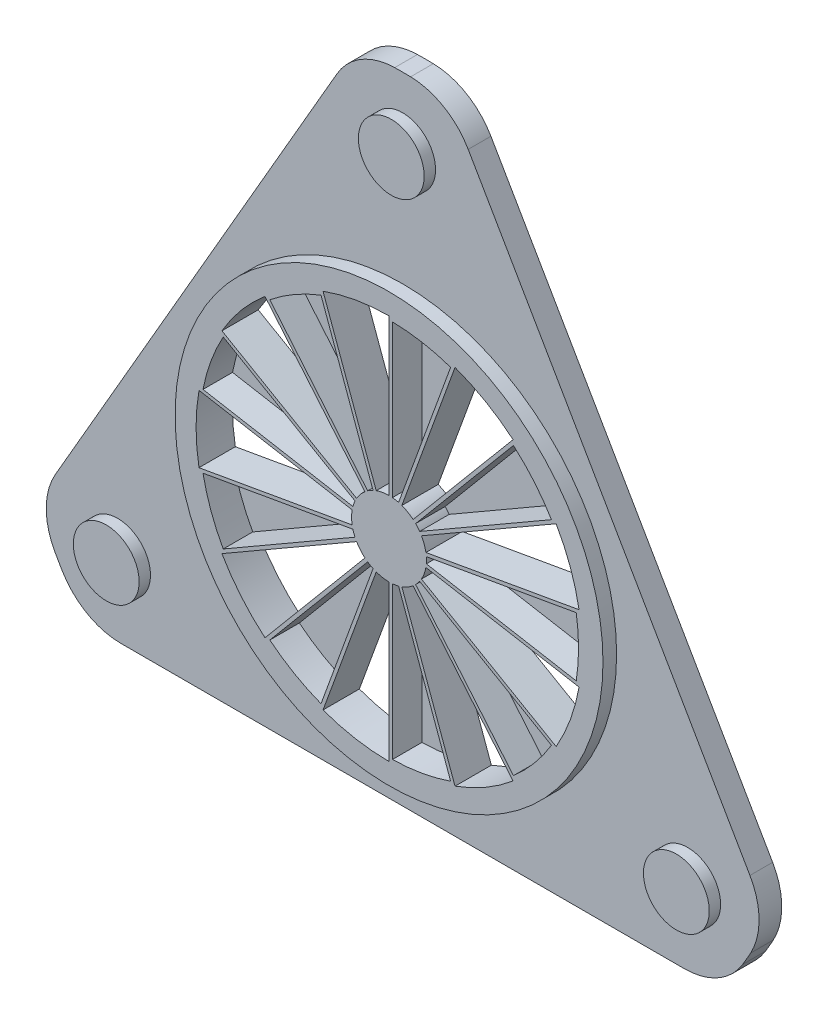
from build123d import *
from build123d.topology import SkipClean

# Parameters (mm, degrees)
SKETCH2_R           = 18.85
BOSS_EXTRUDE1_DEPTH = 3.2
BOSS_EXTRUDE7_START = -0.6
BOSS_EXTRUDE7_DEPTH = 0.6
FILLET1_START       = 6.8
FILLET1_OUTLINE_R   = 18.85
FILLET1_DEPTH       = 2
FILLET1_START_2     = 8.8
FILLET1_2_OUTLINE_R = 2.9
FILLET1_2_DEPTH     = 1
FILLET1_START_3     = 9.8
FILLET1_3_DEPTH     = 0.2


with BuildPart() as part:
    # Sketch2 → Boss-Extrude1 (new body)
    # profile 1 of 37: a face of its own
    with BuildSketch(Plane.XY.offset(10)):
        Circle(SKETCH2_R)
        with BuildLine():
            ThreePointArc((-5.814342437, 15.974774553), (-2.95201902, 16.741731801), (0, 17))
            ThreePointArc((0, 17), (2.95201902, 16.741731801), (5.814342437, 15.974774553))
            ThreePointArc((5.814342437, 15.974774553), (8.5, 14.722431864), (10.927389365, 13.022755533))
            ThreePointArc((10.927389365, 13.022755533), (13.022755533, 10.927389365), (14.722431864, 8.5))
            ThreePointArc((14.722431864, 8.5), (15.974774553, 5.814342437), (16.741731801, 2.95201902))
            ThreePointArc((16.741731801, 2.95201902), (16.935309868, 1.481647627), (17, 0))
            ThreePointArc((17, 0), (16.935309868, -1.481647627), (16.741731801, -2.95201902))
            ThreePointArc((16.741731801, -2.95201902), (15.974774553, -5.814342437), (14.722431864, -8.5))
            ThreePointArc((14.722431864, -8.5), (13.022755533, -10.927389365), (10.927389365, -13.022755533))
            ThreePointArc((10.927389365, -13.022755533), (8.5, -14.722431864), (5.814342437, -15.974774553))
            ThreePointArc((5.814342437, -15.974774553), (2.95201902, -16.741731801), (0, -17))
            ThreePointArc((0, -17), (-2.95201902, -16.741731801), (-5.814342437, -15.974774553))
            ThreePointArc((-5.814342437, -15.974774553), (-8.5, -14.722431864), (-10.927389365, -13.022755533))
            ThreePointArc((-10.927389365, -13.022755533), (-13.022755533, -10.927389365), (-14.722431864, -8.5))
            ThreePointArc((-14.722431864, -8.5), (-15.974774553, -5.814342437), (-16.741731801, -2.95201902))
            ThreePointArc((-16.741731801, -2.95201902), (-17, 0), (-16.741731801, 2.95201902))
            ThreePointArc((-16.741731801, 2.95201902), (-15.974774553, 5.814342437), (-14.722431864, 8.5))
            ThreePointArc((-14.722431864, 8.5), (-13.022755533, 10.927389365), (-10.927389365, 13.022755533))
            ThreePointArc((-10.927389365, 13.022755533), (-8.5, 14.722431864), (-5.814342437, 15.974774553))
        make_face(mode=Mode.SUBTRACT)
    # profile 2 of 37: a face of its own
    with BuildSketch(Plane.XY.offset(10)):
        with BuildLine():
            Line((0, 17), (0, 16.697537549))
            ThreePointArc((0, 16.697537549), (0.150006053, 16.696863729), (0.3, 16.694842323))
            ThreePointArc((0.3, 16.694842323), (2.899496967, 16.443864434), (5.428064578, 15.790626179))
            ThreePointArc((5.428064578, 15.790626179), (5.569704144, 15.741224728), (5.710894186, 15.69055282))
            Line((5.710894186, 15.69055282), (5.814342437, 15.974774553))
            ThreePointArc((5.814342437, 15.974774553), (2.95201902, 16.741731801), (0, 17))
        make_face()
    # profile 3 of 37: a face of its own
    with BuildSketch(Plane.XY.offset(10)):
        with BuildLine():
            ThreePointArc((-5.99188015, 15.585414093), (-5.851623307, 15.638614544), (-5.710894186, 15.69055282))
            Line((-5.710894186, 15.69055282), (-5.814342437, 15.974774553))
            ThreePointArc((-5.814342437, 15.974774553), (-8.5, 14.722431864), (-10.927389365, 13.022755533))
            Line((-10.927389365, 13.022755533), (-10.732970249, 12.791055853))
            ThreePointArc((-10.732970249, 12.791055853), (-10.617625822, 12.886961709), (-10.501424458, 12.981827473))
            ThreePointArc((-10.501424458, 12.981827473), (-8.348768774, 14.460491698), (-5.99188015, 15.585414093))
        make_face()
    # profile 4 of 37: a face of its own
    with BuildSketch(Plane.XY.offset(10)):
        with BuildLine():
            ThreePointArc((-14.608157564, 8.08761354), (-14.534911179, 8.218522811), (-14.460491698, 8.348768774))
            Line((-14.460491698, 8.348768774), (-14.722431864, 8.5))
            ThreePointArc((-14.722431864, 8.5), (-15.974774553, 5.814342437), (-16.741731801, 2.95201902))
            Line((-16.741731801, 2.95201902), (-16.443864434, 2.899496967))
            ThreePointArc((-16.443864434, 2.899496967), (-16.417152573, 3.047107084), (-16.389115702, 3.194471272))
            ThreePointArc((-16.389115702, 3.194471272), (-15.69055282, 5.710894186), (-14.608157564, 8.08761354))
        make_face()
    # profile 5 of 37: a face of its own
    with BuildSketch(Plane.XY.offset(10)):
        with BuildLine():
            ThreePointArc((-16.389115702, -3.194471272), (-16.417152573, -3.047107084), (-16.443864434, -2.899496967))
            Line((-16.443864434, -2.899496967), (-16.741731801, -2.95201902))
            ThreePointArc((-16.741731801, -2.95201902), (-15.974774553, -5.814342437), (-14.722431864, -8.5))
            Line((-14.722431864, -8.5), (-14.460491698, -8.348768774))
            ThreePointArc((-14.460491698, -8.348768774), (-14.534911179, -8.218522811), (-14.608157564, -8.08761354))
            ThreePointArc((-14.608157564, -8.08761354), (-15.69055282, -5.710894186), (-16.389115702, -3.194471272))
        make_face()
    # profile 6 of 37: a face of its own
    with BuildSketch(Plane.XY.offset(10)):
        with BuildLine():
            ThreePointArc((-10.501424458, -12.981827473), (-10.617625822, -12.886961709), (-10.732970249, -12.791055853))
            Line((-10.732970249, -12.791055853), (-10.927389365, -13.022755533))
            ThreePointArc((-10.927389365, -13.022755533), (-8.5, -14.722431864), (-5.814342437, -15.974774553))
            Line((-5.814342437, -15.974774553), (-5.710894186, -15.69055282))
            ThreePointArc((-5.710894186, -15.69055282), (-5.851623307, -15.638614544), (-5.99188015, -15.585414093))
            ThreePointArc((-5.99188015, -15.585414093), (-8.348768774, -14.460491698), (-10.501424458, -12.981827473))
        make_face()
    # profile 7 of 37: a face of its own
    with BuildSketch(Plane.XY.offset(10)):
        with BuildLine():
            Line((5.814342437, -15.974774553), (5.710894186, -15.69055282))
            ThreePointArc((5.710894186, -15.69055282), (5.569704144, -15.741224728), (5.428064578, -15.790626179))
            ThreePointArc((5.428064578, -15.790626179), (2.899496967, -16.443864434), (0.3, -16.694842323))
            ThreePointArc((0.3, -16.694842323), (0.150006053, -16.696863729), (0, -16.697537549))
            Line((0, -16.697537549), (0, -17))
            ThreePointArc((0, -17), (2.95201902, -16.741731801), (5.814342437, -15.974774553))
        make_face()
    # profile 8 of 37: a face of its own
    with BuildSketch(Plane.XY.offset(10)):
        with BuildLine():
            Line((14.722431864, -8.5), (14.460491698, -8.348768774))
            ThreePointArc((14.460491698, -8.348768774), (14.384905126, -8.478340917), (14.308157564, -8.607228783))
            ThreePointArc((14.308157564, -8.607228783), (12.791055853, -10.732970249), (10.961051124, -12.596154907))
            ThreePointArc((10.961051124, -12.596154907), (10.847448429, -12.694117644), (10.732970249, -12.791055853))
            Line((10.732970249, -12.791055853), (10.927389365, -13.022755533))
            ThreePointArc((10.927389365, -13.022755533), (13.022755533, -10.927389365), (14.722431864, -8.5))
        make_face()
    # profile 9 of 37: a face of its own
    with BuildSketch(Plane.XY.offset(10)):
        with BuildLine():
            ThreePointArc((0.842085099, 3.190751116), (0.986397435, 3.149130054), (1.128666473, 3.100985649))
            Line((1.128666473, 3.100985649), (5.710894186, 15.69055282))
            ThreePointArc((5.710894186, 15.69055282), (5.569704144, 15.741224728), (5.428064578, 15.790626179))
            Line((5.428064578, 15.790626179), (0.842085099, 3.190751116))
        make_face()
    # profile 10 of 37: a face of its own
    with BuildSketch(Plane.XY.offset(10)):
        with BuildLine():
            Line((0, 16.697537549), (0, 3.3))
            ThreePointArc((0, 3.3), (0.150155522, 3.296582066), (0.3, 3.286335345))
            Line((0.3, 3.286335345), (0.3, 16.694842323))
            ThreePointArc((0.3, 16.694842323), (0.150006053, 16.696863729), (0, 16.697537549))
        make_face()
    # profile 11 of 37: a face of its own
    with BuildSketch(Plane.XY.offset(10)):
        with BuildLine():
            ThreePointArc((-1.405900672, 2.98553903), (-1.268597506, 3.046417628), (-1.128666473, 3.100985649))
            Line((-1.128666473, 3.100985649), (-5.710894186, 15.69055282))
            ThreePointArc((-5.710894186, 15.69055282), (-5.851623307, 15.638614544), (-5.99188015, 15.585414093))
            Line((-5.99188015, 15.585414093), (-1.405900672, 2.98553903))
        make_face()
    # profile 12 of 37: a face of its own
    with BuildSketch(Plane.XY.offset(10)):
        with BuildLine():
            Line((-10.732970249, 12.791055853), (-2.121199112, 2.527946662))
            ThreePointArc((-2.121199112, 2.527946662), (-2.003976303, 2.621846482), (-1.882602308, 2.710315212))
            Line((-1.882602308, 2.710315212), (-10.501424458, 12.981827473))
            ThreePointArc((-10.501424458, 12.981827473), (-10.617625822, 12.886961709), (-10.732970249, 12.791055853))
        make_face()
    # profile 13 of 37: a face of its own
    with BuildSketch(Plane.XY.offset(10)):
        with BuildLine():
            ThreePointArc((-2.996049894, 1.383360051), (-2.930001576, 1.518252537), (-2.857883832, 1.65))
            Line((-2.857883832, 1.65), (-14.460491698, 8.348768774))
            ThreePointArc((-14.460491698, 8.348768774), (-14.534911179, 8.218522811), (-14.608157564, 8.08761354))
            Line((-14.608157564, 8.08761354), (-2.996049894, 1.383360051))
        make_face()
    # profile 14 of 37: a face of its own
    with BuildSketch(Plane.XY.offset(10)):
        with BuildLine():
            Line((-16.443864434, 2.899496967), (-3.249865585, 0.573038986))
            ThreePointArc((-3.249865585, 0.573038986), (-3.220425345, 0.72031979), (-3.184314073, 0.86610847))
            Line((-3.184314073, 0.86610847), (-16.389115702, 3.194471272))
            ThreePointArc((-16.389115702, 3.194471272), (-16.417152573, 3.047107084), (-16.443864434, 2.899496967))
        make_face()
    # profile 15 of 37: a face of its own
    with BuildSketch(Plane.XY.offset(10)):
        with BuildLine():
            ThreePointArc((-3.184314073, -0.86610847), (-3.220425345, -0.72031979), (-3.249865585, -0.573038986))
            Line((-3.249865585, -0.573038986), (-16.443864434, -2.899496967))
            ThreePointArc((-16.443864434, -2.899496967), (-16.417152573, -3.047107084), (-16.389115702, -3.194471272))
            Line((-16.389115702, -3.194471272), (-3.184314073, -0.86610847))
        make_face()
    # profile 16 of 37: a face of its own
    with BuildSketch(Plane.XY.offset(10)):
        with BuildLine():
            Line((-14.460491698, -8.348768774), (-2.857883832, -1.65))
            ThreePointArc((-2.857883832, -1.65), (-2.930001576, -1.518252537), (-2.996049894, -1.383360051))
            Line((-2.996049894, -1.383360051), (-14.608157564, -8.08761354))
            ThreePointArc((-14.608157564, -8.08761354), (-14.534911179, -8.218522811), (-14.460491698, -8.348768774))
        make_face()
    # profile 17 of 37: a face of its own
    with BuildSketch(Plane.XY.offset(10)):
        with BuildLine():
            ThreePointArc((-1.882602308, -2.710315212), (-2.003976303, -2.621846482), (-2.121199112, -2.527946662))
            Line((-2.121199112, -2.527946662), (-10.732970249, -12.791055853))
            ThreePointArc((-10.732970249, -12.791055853), (-10.617625822, -12.886961709), (-10.501424458, -12.981827473))
            Line((-10.501424458, -12.981827473), (-1.882602308, -2.710315212))
        make_face()
    # profile 18 of 37: a face of its own
    with BuildSketch(Plane.XY.offset(10)):
        with BuildLine():
            Line((-5.710894186, -15.69055282), (-1.128666473, -3.100985649))
            ThreePointArc((-1.128666473, -3.100985649), (-1.268597506, -3.046417628), (-1.405900672, -2.98553903))
            Line((-1.405900672, -2.98553903), (-5.99188015, -15.585414093))
            ThreePointArc((-5.99188015, -15.585414093), (-5.851623307, -15.638614544), (-5.710894186, -15.69055282))
        make_face()
    # profile 19 of 37: a face of its own
    with BuildSketch(Plane.XY.offset(10)):
        with BuildLine():
            ThreePointArc((0.3, -3.286335345), (0.150155522, -3.296582066), (0, -3.3))
            Line((0, -3.3), (0, -16.697537549))
            ThreePointArc((0, -16.697537549), (0.150006053, -16.696863729), (0.3, -16.694842323))
            Line((0.3, -16.694842323), (0.3, -3.286335345))
        make_face()
    # profile 20 of 37: a face of its own
    with BuildSketch(Plane.XY.offset(10)):
        with BuildLine():
            Line((5.710894186, -15.69055282), (1.128666473, -3.100985649))
            ThreePointArc((1.128666473, -3.100985649), (0.986397435, -3.149130054), (0.842085099, -3.190751116))
            Line((0.842085099, -3.190751116), (5.428064578, -15.790626179))
            ThreePointArc((5.428064578, -15.790626179), (5.569704144, -15.741224728), (5.710894186, -15.69055282))
        make_face()
    # profile 21 of 37: a face of its own
    with BuildSketch(Plane.XY.offset(10)):
        with BuildLine():
            ThreePointArc((2.342228974, -2.324642646), (2.234027909, -2.428810264), (2.121199112, -2.527946662))
            Line((2.121199112, -2.527946662), (10.732970249, -12.791055853))
            ThreePointArc((10.732970249, -12.791055853), (10.847448429, -12.694117644), (10.961051124, -12.596154907))
            Line((10.961051124, -12.596154907), (2.342228974, -2.324642646))
        make_face()
    # profile 22 of 37: a face of its own
    with BuildSketch(Plane.XY.offset(10)):
        with BuildLine():
            Line((14.460491698, -8.348768774), (2.857883832, -1.65))
            ThreePointArc((2.857883832, -1.65), (2.779846054, -1.778329529), (2.696049894, -1.902975294))
            Line((2.696049894, -1.902975294), (14.308157564, -8.607228783))
            ThreePointArc((14.308157564, -8.607228783), (14.384905126, -8.478340917), (14.460491698, -8.348768774))
        make_face()
    # profile 23 of 37: a face of its own
    with BuildSketch(Plane.XY.offset(10)):
        with BuildLine():
            Line((0, 3.3), (0, 2.988310559))
            ThreePointArc((0, 2.988310559), (0.518914683, 2.942911407), (1.022062406, 2.808093381))
            Line((1.022062406, 2.808093381), (1.128666473, 3.100985649))
            ThreePointArc((1.128666473, 3.100985649), (0.986397435, 3.149130054), (0.842085099, 3.190751116))
            ThreePointArc((0.842085099, 3.190751116), (0.573038986, 3.249865585), (0.3, 3.286335345))
            ThreePointArc((0.3, 3.286335345), (0.150155522, 3.296582066), (0, 3.3))
        make_face()
    # profile 24 of 37: a face of its own
    with BuildSketch(Plane.XY.offset(10)):
        with BuildLine():
            ThreePointArc((-1.920849002, 2.289178698), (-1.49415528, 2.587952859), (-1.022062406, 2.808093381))
            Line((-1.022062406, 2.808093381), (-1.128666473, 3.100985649))
            ThreePointArc((-1.128666473, 3.100985649), (-1.268597506, 3.046417628), (-1.405900672, 2.98553903))
            ThreePointArc((-1.405900672, 2.98553903), (-1.65, 2.857883832), (-1.882602308, 2.710315212))
            ThreePointArc((-1.882602308, 2.710315212), (-2.003976303, 2.621846482), (-2.121199112, 2.527946662))
            Line((-2.121199112, 2.527946662), (-1.920849002, 2.289178698))
        make_face()
    # profile 25 of 37: a face of its own
    with BuildSketch(Plane.XY.offset(10)):
        with BuildLine():
            ThreePointArc((-2.942911407, 0.518914683), (-2.808093381, 1.022062406), (-2.587952859, 1.49415528))
            Line((-2.587952859, 1.49415528), (-2.857883832, 1.65))
            ThreePointArc((-2.857883832, 1.65), (-2.930001576, 1.518252537), (-2.996049894, 1.383360051))
            ThreePointArc((-2.996049894, 1.383360051), (-3.100985649, 1.128666473), (-3.184314073, 0.86610847))
            ThreePointArc((-3.184314073, 0.86610847), (-3.220425345, 0.72031979), (-3.249865585, 0.573038986))
            Line((-3.249865585, 0.573038986), (-2.942911407, 0.518914683))
        make_face()
    # profile 26 of 37: a face of its own
    with BuildSketch(Plane.XY.offset(10)):
        with BuildLine():
            ThreePointArc((-2.587952859, -1.49415528), (-2.808093381, -1.022062406), (-2.942911407, -0.518914683))
            Line((-2.942911407, -0.518914683), (-3.249865585, -0.573038986))
            ThreePointArc((-3.249865585, -0.573038986), (-3.220425345, -0.72031979), (-3.184314073, -0.86610847))
            ThreePointArc((-3.184314073, -0.86610847), (-3.100985649, -1.128666473), (-2.996049894, -1.383360051))
            ThreePointArc((-2.996049894, -1.383360051), (-2.930001576, -1.518252537), (-2.857883832, -1.65))
            Line((-2.857883832, -1.65), (-2.587952859, -1.49415528))
        make_face()
    # profile 27 of 37: a face of its own
    with BuildSketch(Plane.XY.offset(10)):
        with BuildLine():
            ThreePointArc((-1.022062406, -2.808093381), (-1.49415528, -2.587952859), (-1.920849002, -2.289178698))
            Line((-1.920849002, -2.289178698), (-2.121199112, -2.527946662))
            ThreePointArc((-2.121199112, -2.527946662), (-2.003976303, -2.621846482), (-1.882602308, -2.710315212))
            ThreePointArc((-1.882602308, -2.710315212), (-1.65, -2.857883832), (-1.405900672, -2.98553903))
            ThreePointArc((-1.405900672, -2.98553903), (-1.268597506, -3.046417628), (-1.128666473, -3.100985649))
            Line((-1.128666473, -3.100985649), (-1.022062406, -2.808093381))
        make_face()
    # profile 28 of 37: a face of its own
    with BuildSketch(Plane.XY.offset(10)):
        with BuildLine():
            Line((1.128666473, -3.100985649), (1.022062406, -2.808093381))
            ThreePointArc((1.022062406, -2.808093381), (0.518914683, -2.942911407), (0, -2.988310559))
            Line((0, -2.988310559), (0, -3.3))
            ThreePointArc((0, -3.3), (0.150155522, -3.296582066), (0.3, -3.286335345))
            ThreePointArc((0.3, -3.286335345), (0.573038986, -3.249865585), (0.842085099, -3.190751116))
            ThreePointArc((0.842085099, -3.190751116), (0.986397435, -3.149130054), (1.128666473, -3.100985649))
        make_face()
    # profile 29 of 37: a face of its own
    with BuildSketch(Plane.XY.offset(10)):
        with BuildLine():
            Line((2.857883832, -1.65), (2.587952859, -1.49415528))
            ThreePointArc((2.587952859, -1.49415528), (2.289178698, -1.920849002), (1.920849002, -2.289178698))
            Line((1.920849002, -2.289178698), (2.121199112, -2.527946662))
            ThreePointArc((2.121199112, -2.527946662), (2.234027909, -2.428810264), (2.342228974, -2.324642646))
            ThreePointArc((2.342228974, -2.324642646), (2.527946662, -2.121199112), (2.696049894, -1.902975294))
            ThreePointArc((2.696049894, -1.902975294), (2.779846054, -1.778329529), (2.857883832, -1.65))
        make_face()
    # profile 30 of 37: a face of its own
    with BuildSketch(Plane.XY.offset(10)):
        with BuildLine():
            Line((3.249865585, 0.573038986), (2.942911407, 0.518914683))
            ThreePointArc((2.942911407, 0.518914683), (2.976939136, 0.260448426), (2.988310559, 0))
            ThreePointArc((2.988310559, 0), (2.976939136, -0.260448426), (2.942911407, -0.518914683))
            Line((2.942911407, -0.518914683), (3.249865585, -0.573038986))
            ThreePointArc((3.249865585, -0.573038986), (3.27257381, -0.424571146), (3.28850298, -0.275223818))
            ThreePointArc((3.28850298, -0.275223818), (3.297124492, -0.137731924), (3.3, 0))
            ThreePointArc((3.3, 0), (3.297124492, 0.137731924), (3.28850298, 0.275223818))
            ThreePointArc((3.28850298, 0.275223818), (3.27257381, 0.424571146), (3.249865585, 0.573038986))
        make_face()
    # profile 31 of 37: a face of its own
    with BuildSketch(Plane.XY.offset(10)):
        with BuildLine():
            ThreePointArc((3.28850298, -0.275223818), (3.27257381, -0.424571146), (3.249865585, -0.573038986))
            Line((3.249865585, -0.573038986), (16.443864434, -2.899496967))
            ThreePointArc((16.443864434, -2.899496967), (16.469249129, -2.751652835), (16.493304608, -2.60358662))
            Line((16.493304608, -2.60358662), (3.28850298, -0.275223818))
        make_face()
    # profile 32 of 37: a face of its own
    with BuildSketch(Plane.XY.offset(10)):
        with BuildLine():
            Line((16.443864434, 2.899496967), (3.249865585, 0.573038986))
            ThreePointArc((3.249865585, 0.573038986), (3.27257381, 0.424571146), (3.28850298, 0.275223818))
            Line((3.28850298, 0.275223818), (16.493304608, 2.60358662))
            ThreePointArc((16.493304608, 2.60358662), (16.469249129, 2.751652835), (16.443864434, 2.899496967))
        make_face()
    # profile 33 of 37: a face of its own
    with BuildSketch(Plane.XY.offset(10)):
        with BuildLine():
            Line((16.741731801, 2.95201902), (16.443864434, 2.899496967))
            ThreePointArc((16.443864434, 2.899496967), (16.469249129, 2.751652835), (16.493304608, 2.60358662))
            ThreePointArc((16.493304608, 2.60358662), (16.64640101, 1.305792325), (16.697537549, 0))
            ThreePointArc((16.697537549, 0), (16.64640101, -1.305792325), (16.493304608, -2.60358662))
            ThreePointArc((16.493304608, -2.60358662), (16.469249129, -2.751652835), (16.443864434, -2.899496967))
            Line((16.443864434, -2.899496967), (16.741731801, -2.95201902))
            ThreePointArc((16.741731801, -2.95201902), (16.935309868, -1.481647627), (17, 0))
            ThreePointArc((17, 0), (16.935309868, 1.481647627), (16.741731801, 2.95201902))
        make_face()
    # profile 34 of 37: a face of its own
    with BuildSketch(Plane.XY.offset(10)):
        with BuildLine():
            Line((2.121199112, 2.527946662), (1.920849002, 2.289178698))
            ThreePointArc((1.920849002, 2.289178698), (2.289178698, 1.920849002), (2.587952859, 1.49415528))
            Line((2.587952859, 1.49415528), (2.857883832, 1.65))
            ThreePointArc((2.857883832, 1.65), (2.779846054, 1.778329529), (2.696049894, 1.902975294))
            ThreePointArc((2.696049894, 1.902975294), (2.527946662, 2.121199112), (2.342228974, 2.324642646))
            ThreePointArc((2.342228974, 2.324642646), (2.234027909, 2.428810264), (2.121199112, 2.527946662))
        make_face()
    # profile 35 of 37: a face of its own
    with BuildSketch(Plane.XY.offset(10)):
        with BuildLine():
            ThreePointArc((2.696049894, 1.902975294), (2.779846054, 1.778329529), (2.857883832, 1.65))
            Line((2.857883832, 1.65), (14.460491698, 8.348768774))
            ThreePointArc((14.460491698, 8.348768774), (14.384905126, 8.478340917), (14.308157564, 8.607228783))
            Line((14.308157564, 8.607228783), (2.696049894, 1.902975294))
        make_face()
    # profile 36 of 37: a face of its own
    with BuildSketch(Plane.XY.offset(10)):
        with BuildLine():
            Line((10.732970249, 12.791055853), (2.121199112, 2.527946662))
            ThreePointArc((2.121199112, 2.527946662), (2.234027909, 2.428810264), (2.342228974, 2.324642646))
            Line((2.342228974, 2.324642646), (10.961051124, 12.596154907))
            ThreePointArc((10.961051124, 12.596154907), (10.847448429, 12.694117644), (10.732970249, 12.791055853))
        make_face()
    # profile 37 of 37: a face of its own
    with BuildSketch(Plane.XY.offset(10)):
        with BuildLine():
            Line((10.927389365, 13.022755533), (10.732970249, 12.791055853))
            ThreePointArc((10.732970249, 12.791055853), (10.847448429, 12.694117644), (10.961051124, 12.596154907))
            ThreePointArc((10.961051124, 12.596154907), (12.791055853, 10.732970249), (14.308157564, 8.607228783))
            ThreePointArc((14.308157564, 8.607228783), (14.384905126, 8.478340917), (14.460491698, 8.348768774))
            Line((14.460491698, 8.348768774), (14.722431864, 8.5))
            ThreePointArc((14.722431864, 8.5), (13.022755533, 10.927389365), (10.927389365, 13.022755533))
        make_face()
    extrude(amount=-BOSS_EXTRUDE1_DEPTH)

    # Sketch11 → Boss-Extrude7 (add)
    with SkipClean():  # the faces are left unmerged after this step: merging them gives an invalid solid
        with BuildSketch(Plane(origin=(0, 0, 6.8), x_dir=(-1, 0, 0), z_dir=(0, 0, -1)).offset(BOSS_EXTRUDE7_START)):
            with BuildLine():
                ThreePointArc((-1.022062406, 2.808093381), (-0.518914683, 2.942911407), (0, 2.988310559))
                Line((0, 2.988310559), (0, 18.85))
                ThreePointArc((0, 18.85), (-3.273268149, 18.563626144), (-6.447079702, 17.713205902))
                Line((-6.447079702, 17.713205902), (-1.022062406, 2.808093381))
            make_face()
            with BuildLine():
                ThreePointArc((-2.587952859, 1.49415528), (-2.289178698, 1.920849002), (-1.920849002, 2.289178698))
                Line((-1.920849002, 2.289178698), (-12.116546443, 14.439937753))
                ThreePointArc((-12.116546443, 14.439937753), (-14.439937753, 12.116546443), (-16.324578861, 9.425))
                Line((-16.324578861, 9.425), (-2.587952859, 1.49415528))
            make_face()
            with BuildLine():
                ThreePointArc((-2.942911407, -0.518914683), (-2.988310559, 0), (-2.942911407, 0.518914683))
                Line((-2.942911407, 0.518914683), (-18.563626144, 3.273268149))
                ThreePointArc((-18.563626144, 3.273268149), (-18.85, 0), (-18.563626144, -3.273268149))
                Line((-18.563626144, -3.273268149), (-2.942911407, -0.518914683))
            make_face()
            with BuildLine():
                ThreePointArc((-1.920849002, -2.289178698), (-2.289178698, -1.920849002), (-2.587952859, -1.49415528))
                Line((-2.587952859, -1.49415528), (-16.324578861, -9.425))
                ThreePointArc((-16.324578861, -9.425), (-14.439937753, -12.116546443), (-12.116546443, -14.439937753))
                Line((-12.116546443, -14.439937753), (-1.920849002, -2.289178698))
            make_face()
            with BuildLine():
                ThreePointArc((0, -2.988310559), (-0.518914683, -2.942911407), (-1.022062406, -2.808093381))
                Line((-1.022062406, -2.808093381), (-6.447079702, -17.713205902))
                ThreePointArc((-6.447079702, -17.713205902), (-3.273268149, -18.563626144), (0, -18.85))
                Line((0, -18.85), (0, -2.988310559))
            make_face()
            with BuildLine():
                Line((12.116546443, -14.439937753), (1.920849002, -2.289178698))
                ThreePointArc((1.920849002, -2.289178698), (1.49415528, -2.587952859), (1.022062406, -2.808093381))
                Line((1.022062406, -2.808093381), (6.447079702, -17.713205902))
                ThreePointArc((6.447079702, -17.713205902), (9.425, -16.324578861), (12.116546443, -14.439937753))
            make_face()
            with BuildLine():
                Line((18.563626144, -3.273268149), (2.942911407, -0.518914683))
                ThreePointArc((2.942911407, -0.518914683), (2.808093381, -1.022062406), (2.587952859, -1.49415528))
                Line((2.587952859, -1.49415528), (16.324578861, -9.425))
                ThreePointArc((16.324578861, -9.425), (17.713205902, -6.447079702), (18.563626144, -3.273268149))
            make_face()
            with BuildLine():
                Line((16.324578861, 9.425), (2.587952859, 1.49415528))
                ThreePointArc((2.587952859, 1.49415528), (2.808093381, 1.022062406), (2.942911407, 0.518914683))
                Line((2.942911407, 0.518914683), (18.563626144, 3.273268149))
                ThreePointArc((18.563626144, 3.273268149), (17.713205902, 6.447079702), (16.324578861, 9.425))
            make_face()
            with BuildLine():
                Line((6.447079702, 17.713205902), (1.022062406, 2.808093381))
                ThreePointArc((1.022062406, 2.808093381), (1.49415528, 2.587952859), (1.920849002, 2.289178698))
                Line((1.920849002, 2.289178698), (12.116546443, 14.439937753))
                ThreePointArc((12.116546443, 14.439937753), (9.425, 16.324578861), (6.447079702, 17.713205902))
            make_face()
        extrude(amount=BOSS_EXTRUDE7_DEPTH)

    # Fillet1: read off the stored shape, not the designer's step
    # Fillet1 outline → Fillet1 (add)
    # profile 1 of 2: a face of its own
    with BuildSketch(Plane.XY.offset(FILLET1_START)):
        with BuildLine():
            ThreePointArc((0.700853772, 34.992982211), (0, 35), (-0.700853772, 34.992982211))
            ThreePointArc((-0.700853772, 34.992982211), (-3.632584534, 34.160039113), (-5.776859833, 31.99418526))
            Line((-5.776859833, 31.99418526), (-30.596207125, -10.99418526))
            ThreePointArc((-30.596207125, -10.99418526), (-31.399753933, -13.934109068), (-30.655238434, -16.889533935))
            ThreePointArc((-30.655238434, -16.889533935), (-30.310889132, -17.5), (-29.954384663, -18.103448276))
            ThreePointArc((-29.954384663, -18.103448276), (-27.767169399, -20.225930044), (-24.819347292, -21))
            Line((-24.819347292, -21), (24.819347292, -21))
            ThreePointArc((24.819347292, -21), (27.767169399, -20.225930044), (29.954384663, -18.103448276))
            ThreePointArc((29.954384663, -18.103448276), (30.310889132, -17.5), (30.655238434, -16.889533935))
            ThreePointArc((30.655238434, -16.889533935), (31.399753933, -13.934109068), (30.596207125, -10.99418526))
            Line((30.596207125, -10.99418526), (5.776859833, 31.99418526))
            ThreePointArc((5.776859833, 31.99418526), (3.632584534, 34.160039113), (0.700853772, 34.992982211))
        make_face()
        Circle(FILLET1_OUTLINE_R, mode=Mode.SUBTRACT)
    # profile 2 of 2: a face of its own
    with BuildSketch(Plane.XY.offset(FILLET1_START)):
        with BuildLine():
            ThreePointArc((3.249865585, 0.573038986), (3.100985649, 1.128666473), (2.857883832, 1.65))
            Line((2.857883832, 1.65), (2.587952859, 1.49415528))
            ThreePointArc((2.587952859, 1.49415528), (2.289178699, 1.920849001), (1.920849002, 2.289178698))
            Line((1.920849002, 2.289178698), (2.121199112, 2.527946662))
            ThreePointArc((2.121199112, 2.527946662), (1.65, 2.857883832), (1.128666473, 3.100985649))
            Line((1.128666473, 3.100985649), (1.022062406, 2.808093381))
            ThreePointArc((1.022062406, 2.808093381), (0.518914683, 2.942911407), (0, 2.988310559))
            Line((0, 2.988310559), (0, 3.3))
            ThreePointArc((0, 3.3), (-0.573038986, 3.249865585), (-1.128666473, 3.100985649))
            Line((-1.128666473, 3.100985649), (-1.022062406, 2.808093381))
            ThreePointArc((-1.022062406, 2.808093381), (-1.49415528, 2.587952859), (-1.920849002, 2.289178698))
            Line((-1.920849002, 2.289178698), (-2.121199112, 2.527946662))
            ThreePointArc((-2.121199112, 2.527946662), (-2.527946662, 2.121199112), (-2.857883832, 1.65))
            Line((-2.857883832, 1.65), (-2.587952859, 1.49415528))
            ThreePointArc((-2.587952859, 1.49415528), (-2.808093381, 1.022062406), (-2.942911407, 0.518914683))
            Line((-2.942911407, 0.518914683), (-3.249865585, 0.573038986))
            ThreePointArc((-3.249865585, 0.573038986), (-3.3, 0), (-3.249865585, -0.573038986))
            Line((-3.249865585, -0.573038986), (-2.942911407, -0.518914683))
            ThreePointArc((-2.942911407, -0.518914683), (-2.808093381, -1.022062406), (-2.587952859, -1.49415528))
            Line((-2.587952859, -1.49415528), (-2.857883832, -1.65))
            ThreePointArc((-2.857883832, -1.65), (-2.527946662, -2.121199112), (-2.121199112, -2.527946662))
            Line((-2.121199112, -2.527946662), (-1.920849002, -2.289178698))
            ThreePointArc((-1.920849002, -2.289178698), (-1.49415528, -2.587952859), (-1.022062406, -2.808093381))
            Line((-1.022062406, -2.808093381), (-1.128666473, -3.100985649))
            ThreePointArc((-1.128666473, -3.100985649), (-0.573038986, -3.249865585), (0, -3.3))
            Line((0, -3.3), (0, -2.988310559))
            ThreePointArc((0, -2.988310559), (0.518914683, -2.942911407), (1.022062406, -2.808093381))
            Line((1.022062406, -2.808093381), (1.128666473, -3.100985649))
            ThreePointArc((1.128666473, -3.100985649), (1.65, -2.857883832), (2.121199112, -2.527946662))
            Line((2.121199112, -2.527946662), (1.920849002, -2.289178698))
            ThreePointArc((1.920849002, -2.289178698), (2.289178699, -1.920849001), (2.587952859, -1.49415528))
            Line((2.587952859, -1.49415528), (2.857883832, -1.65))
            ThreePointArc((2.857883832, -1.65), (3.100985649, -1.128666473), (3.249865585, -0.573038986))
            Line((3.249865585, -0.573038986), (2.942911407, -0.518914683))
            ThreePointArc((2.942911407, -0.518914683), (2.988310559, 0), (2.942911407, 0.518914683))
            Line((2.942911407, 0.518914683), (3.249865585, 0.573038986))
        make_face()
    extrude(amount=FILLET1_DEPTH)

    # Fillet1 2 outline → Fillet1 2 (add)
    with BuildSketch(Plane.XY.offset(FILLET1_START_2)):
        with BuildLine():
            ThreePointArc((3.249865585, 0.573038986), (3.100985649, 1.128666473), (2.857883832, 1.65))
            Line((2.857883832, 1.65), (2.587952859, 1.49415528))
            ThreePointArc((2.587952859, 1.49415528), (2.289178699, 1.920849001), (1.920849002, 2.289178698))
            Line((1.920849002, 2.289178698), (2.121199112, 2.527946662))
            ThreePointArc((2.121199112, 2.527946662), (1.65, 2.857883832), (1.128666473, 3.100985649))
            Line((1.128666473, 3.100985649), (1.022062406, 2.808093381))
            ThreePointArc((1.022062406, 2.808093381), (0.518914683, 2.942911407), (0, 2.988310559))
            Line((0, 2.988310559), (0, 3.3))
            ThreePointArc((0, 3.3), (-0.573038986, 3.249865585), (-1.128666473, 3.100985649))
            Line((-1.128666473, 3.100985649), (-1.022062406, 2.808093381))
            ThreePointArc((-1.022062406, 2.808093381), (-1.49415528, 2.587952859), (-1.920849002, 2.289178698))
            Line((-1.920849002, 2.289178698), (-2.121199112, 2.527946662))
            ThreePointArc((-2.121199112, 2.527946662), (-2.527946662, 2.121199112), (-2.857883832, 1.65))
            Line((-2.857883832, 1.65), (-2.587952859, 1.49415528))
            ThreePointArc((-2.587952859, 1.49415528), (-2.808093381, 1.022062406), (-2.942911407, 0.518914683))
            Line((-2.942911407, 0.518914683), (-3.249865585, 0.573038986))
            ThreePointArc((-3.249865585, 0.573038986), (-3.3, 0), (-3.249865585, -0.573038986))
            Line((-3.249865585, -0.573038986), (-2.942911407, -0.518914683))
            ThreePointArc((-2.942911407, -0.518914683), (-2.808093381, -1.022062406), (-2.587952859, -1.49415528))
            Line((-2.587952859, -1.49415528), (-2.857883832, -1.65))
            ThreePointArc((-2.857883832, -1.65), (-2.527946662, -2.121199112), (-2.121199112, -2.527946662))
            Line((-2.121199112, -2.527946662), (-1.920849002, -2.289178698))
            ThreePointArc((-1.920849002, -2.289178698), (-1.49415528, -2.587952859), (-1.022062406, -2.808093381))
            Line((-1.022062406, -2.808093381), (-1.128666473, -3.100985649))
            ThreePointArc((-1.128666473, -3.100985649), (-0.573038986, -3.249865585), (0, -3.3))
            Line((0, -3.3), (0, -2.988310559))
            ThreePointArc((0, -2.988310559), (0.518914683, -2.942911407), (1.022062406, -2.808093381))
            Line((1.022062406, -2.808093381), (1.128666473, -3.100985649))
            ThreePointArc((1.128666473, -3.100985649), (1.65, -2.857883832), (2.121199112, -2.527946662))
            Line((2.121199112, -2.527946662), (1.920849002, -2.289178698))
            ThreePointArc((1.920849002, -2.289178698), (2.289178699, -1.920849001), (2.587952859, -1.49415528))
            Line((2.587952859, -1.49415528), (2.857883832, -1.65))
            ThreePointArc((2.857883832, -1.65), (3.100985649, -1.128666473), (3.249865585, -0.573038986))
            Line((3.249865585, -0.573038986), (2.942911407, -0.518914683))
            ThreePointArc((2.942911407, -0.518914683), (2.988310559, 0), (2.942911407, 0.518914683))
            Line((2.942911407, 0.518914683), (3.249865585, 0.573038986))
        make_face()
        with Locations((0, 29)):
            Circle(FILLET1_2_OUTLINE_R)
        with Locations((-25.11473671, -14.5)):
            Circle(FILLET1_2_OUTLINE_R)
        with Locations((25.11473671, -14.5)):
            Circle(FILLET1_2_OUTLINE_R)
    extrude(amount=FILLET1_2_DEPTH)

    # Fillet1 3 outline → Fillet1 3 (add)
    with BuildSketch(Plane.XY.offset(FILLET1_START_3)):
        with BuildLine():
            ThreePointArc((3.249865585, 0.573038986), (3.100985649, 1.128666473), (2.857883832, 1.65))
            Line((2.857883832, 1.65), (2.587952859, 1.49415528))
            ThreePointArc((2.587952859, 1.49415528), (2.289178699, 1.920849001), (1.920849002, 2.289178698))
            Line((1.920849002, 2.289178698), (2.121199112, 2.527946662))
            ThreePointArc((2.121199112, 2.527946662), (1.65, 2.857883832), (1.128666473, 3.100985649))
            Line((1.128666473, 3.100985649), (1.022062406, 2.808093381))
            ThreePointArc((1.022062406, 2.808093381), (0.518914683, 2.942911407), (0, 2.988310559))
            Line((0, 2.988310559), (0, 3.3))
            ThreePointArc((0, 3.3), (-0.573038986, 3.249865585), (-1.128666473, 3.100985649))
            Line((-1.128666473, 3.100985649), (-1.022062406, 2.808093381))
            ThreePointArc((-1.022062406, 2.808093381), (-1.49415528, 2.587952859), (-1.920849002, 2.289178698))
            Line((-1.920849002, 2.289178698), (-2.121199112, 2.527946662))
            ThreePointArc((-2.121199112, 2.527946662), (-2.527946662, 2.121199112), (-2.857883832, 1.65))
            Line((-2.857883832, 1.65), (-2.587952859, 1.49415528))
            ThreePointArc((-2.587952859, 1.49415528), (-2.808093381, 1.022062406), (-2.942911407, 0.518914683))
            Line((-2.942911407, 0.518914683), (-3.249865585, 0.573038986))
            ThreePointArc((-3.249865585, 0.573038986), (-3.3, 0), (-3.249865585, -0.573038986))
            Line((-3.249865585, -0.573038986), (-2.942911407, -0.518914683))
            ThreePointArc((-2.942911407, -0.518914683), (-2.808093381, -1.022062406), (-2.587952859, -1.49415528))
            Line((-2.587952859, -1.49415528), (-2.857883832, -1.65))
            ThreePointArc((-2.857883832, -1.65), (-2.527946662, -2.121199112), (-2.121199112, -2.527946662))
            Line((-2.121199112, -2.527946662), (-1.920849002, -2.289178698))
            ThreePointArc((-1.920849002, -2.289178698), (-1.49415528, -2.587952859), (-1.022062406, -2.808093381))
            Line((-1.022062406, -2.808093381), (-1.128666473, -3.100985649))
            ThreePointArc((-1.128666473, -3.100985649), (-0.573038986, -3.249865585), (0, -3.3))
            Line((0, -3.3), (0, -2.988310559))
            ThreePointArc((0, -2.988310559), (0.518914683, -2.942911407), (1.022062406, -2.808093381))
            Line((1.022062406, -2.808093381), (1.128666473, -3.100985649))
            ThreePointArc((1.128666473, -3.100985649), (1.65, -2.857883832), (2.121199112, -2.527946662))
            Line((2.121199112, -2.527946662), (1.920849002, -2.289178698))
            ThreePointArc((1.920849002, -2.289178698), (2.289178699, -1.920849001), (2.587952859, -1.49415528))
            Line((2.587952859, -1.49415528), (2.857883832, -1.65))
            ThreePointArc((2.857883832, -1.65), (3.100985649, -1.128666473), (3.249865585, -0.573038986))
            Line((3.249865585, -0.573038986), (2.942911407, -0.518914683))
            ThreePointArc((2.942911407, -0.518914683), (2.988310559, 0), (2.942911407, 0.518914683))
            Line((2.942911407, 0.518914683), (3.249865585, 0.573038986))
        make_face()
    extrude(amount=FILLET1_3_DEPTH)


solid = part.part
